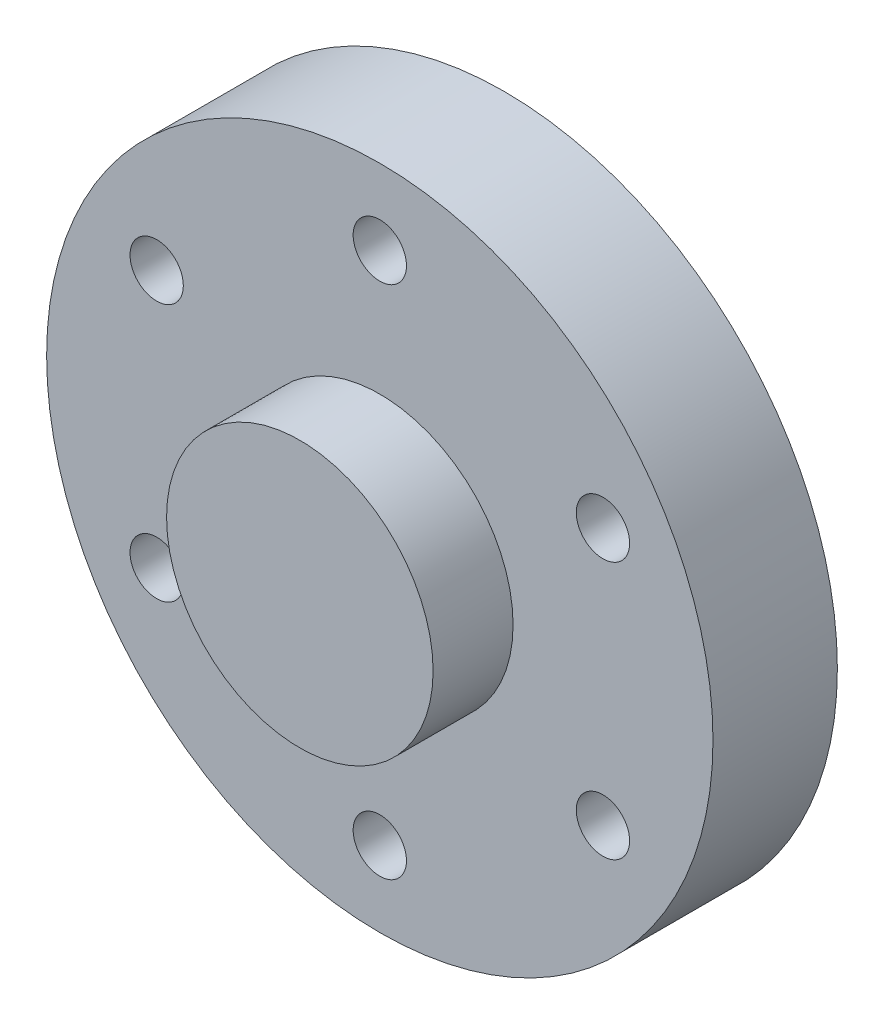
from build123d import *

# Parameters (mm, degrees)
SKETCH2_R           = 18.75
SKETCH2_R_2         = 1.5
BOSS_EXTRUDE1_DEPTH = 7
SKETCH3_R           = 7.5
BOSS_EXTRUDE2_DEPTH = 4.5
BOSS_EXTRUDE4_START = 4.5
SKETCH6_R           = 7.5
BOSS_EXTRUDE4_DEPTH = 4.5
SKETCH7_R           = 1.75
BOSS_EXTRUDE5_DEPTH = 1
FILLET2_R           = 0.05
SKETCH9_R           = 1.4
CUT_EXTRUDE1_DEPTH  = 10


with BuildPart() as part:
    # Sketch2 → Boss-Extrude1 (new body)
    with BuildSketch(Plane.XY):
        Circle(SKETCH2_R)
        with Locations((0, -14.5)):
            Circle(SKETCH2_R_2, mode=Mode.SUBTRACT)
        with Locations((-12.557368355, -7.25)):
            Circle(SKETCH2_R_2, mode=Mode.SUBTRACT)
        with Locations((12.557368355, -7.25)):
            Circle(SKETCH2_R_2, mode=Mode.SUBTRACT)
        with Locations((-12.557368355, 7.25)):
            Circle(SKETCH2_R_2, mode=Mode.SUBTRACT)
        with Locations((0, 14.5)):
            Circle(SKETCH2_R_2, mode=Mode.SUBTRACT)
        with Locations((12.557368355, 7.25)):
            Circle(SKETCH2_R_2, mode=Mode.SUBTRACT)
    extrude(amount=BOSS_EXTRUDE1_DEPTH)

    # Sketch3 → Boss-Extrude2 (add)
    with BuildSketch(Plane.XY.offset(7)):
        Circle(SKETCH3_R)
    extrude(amount=BOSS_EXTRUDE2_DEPTH)

    # Sketch6 → Boss-Extrude4 (add)
    with BuildSketch(Plane(origin=(0, 0, 0), x_dir=(-1, 0, 0), z_dir=(0, 0, -1)).offset(BOSS_EXTRUDE4_START)):
        Circle(SKETCH6_R)
    extrude(amount=-BOSS_EXTRUDE4_DEPTH)

    # Sketch7 → Boss-Extrude5 (add)
    with BuildSketch(Plane(origin=(0, 0, -4.5), x_dir=(-1, 0, 0), z_dir=(0, 0, -1))):
        Circle(SKETCH7_R)
    extrude(amount=BOSS_EXTRUDE5_DEPTH)

    # Fillet2
    fillet2_edges = [part.edges().sort_by_distance(p)[0] for p in [
        (1.75, 0, -5.5),
    ]]
    fillet(fillet2_edges, radius=FILLET2_R)

    # Sketch9 → Cut-Extrude1 (cut)
    with BuildSketch(Plane(origin=(0, 0, -5.5), x_dir=(-1, 0, 0), z_dir=(0, 0, -1))):
        Circle(SKETCH9_R)
    extrude(amount=-CUT_EXTRUDE1_DEPTH, mode=Mode.SUBTRACT)


solid = part.part
